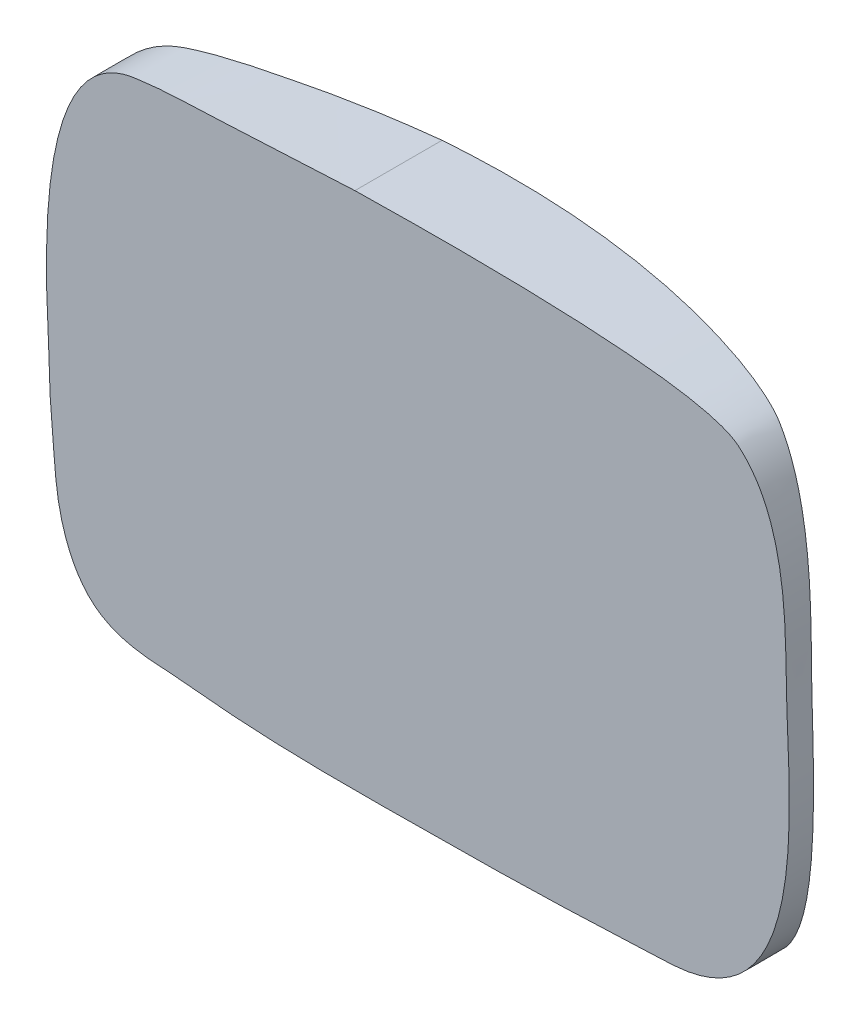
from build123d import *

# Parameters (mm, degrees)
EXTRUDE_1_DEPTH     = 10
CUT_EXTRUDE_2_DEPTH = 50
CUT_EXTRUDE_3_DEPTH = 2


with BuildPart() as part:
    # 스케치1 → 보스-돌출1 (new body)
    with BuildSketch(Plane.XY):
        with BuildLine():
            add(Edge.make_bspline(
                [(-29.288442009, -13.19573609), (-31.939849282, -11.026402867), (-33.008306535, -6.797316626), (-33.288442009, -3.529069423), (-33.564277103, -0.310993326), (-33.915236702, 2.90796739), (-33.955108676, 6.137597243), (-34.015291649, 11.012418115), (-36.498228289, 34.367630989), (-25.288442009, 36.137597243), (-22.098090146, 36.641337011), (-18.846237728, 36.617338554), (-15.621775342, 36.80426391), (-11.179237431, 37.06180234), (-6.732886454, 37.248708354), (-2.288442009, 37.470930577)],
                knots=[6, 6, 6, 6, 7, 7, 7, 8, 8, 8, 9, 9, 9, 10, 10, 10, 11, 11, 11, 11], degree=3))
            add(Edge.make_bspline(
                [(-2.288442009, 37.470930577), (-0.766398092, 37.449187092), (32.571962963, 38.476148655), (37.378224658, 34.470930577), (42.302253046, 30.367573586), (42.308652696, 21.300448881), (42.378224658, 15.80426391), (42.498864518, 6.27371497), (45.558040963, -14.849376156), (30.378224658, -15.529069423), (23.603592703, -15.832411153), (16.826156317, -16.149916732), (10.044891324, -16.19573609), (0.264811866, -16.261817708), (-9.567958231, -16.609123177), (-19.288442009, -15.529069423), (-22.6890963, -15.151218947), (-26.442607952, -15.524145773), (-29.288442009, -13.19573609)],
                knots=[0, 0, 0, 0, 1, 1, 1, 2, 2, 2, 3, 3, 3, 4, 4, 4, 5, 5, 5, 6, 6, 6, 6], degree=3))
        make_face()
    extrude(amount=EXTRUDE_1_DEPTH)

    # 스케치3 → 컷-돌출2 (cut, symmetric)
    with BuildSketch(Plane(origin=(0, 0, 0), x_dir=(1, 0, 0), z_dir=(0, 1, 0))):
        with BuildLine():
            Line((-34.229516124, 0), (42.708521258, 0))
            Line((42.708521258, 0), (42.708521258, -7.5))
            ThreePointArc((42.708521258, -7.5), (4.239502567, -0.783641945), (-34.229516124, -7.5))
            Line((-34.229516124, -7.5), (-34.229516124, 0))
        make_face()
    extrude(amount=CUT_EXTRUDE_2_DEPTH, both=True, mode=Mode.SUBTRACT)

    # 스케치4 → 컷-돌출3 (cut)
    with BuildSketch(Plane.XY):
        Polygon((11.000542022, 22.683160895), (11.000542022, -1.316839105), (-9.784067669, 10.683160895), align=None)
    extrude(amount=CUT_EXTRUDE_3_DEPTH, mode=Mode.SUBTRACT)


solid = part.part
